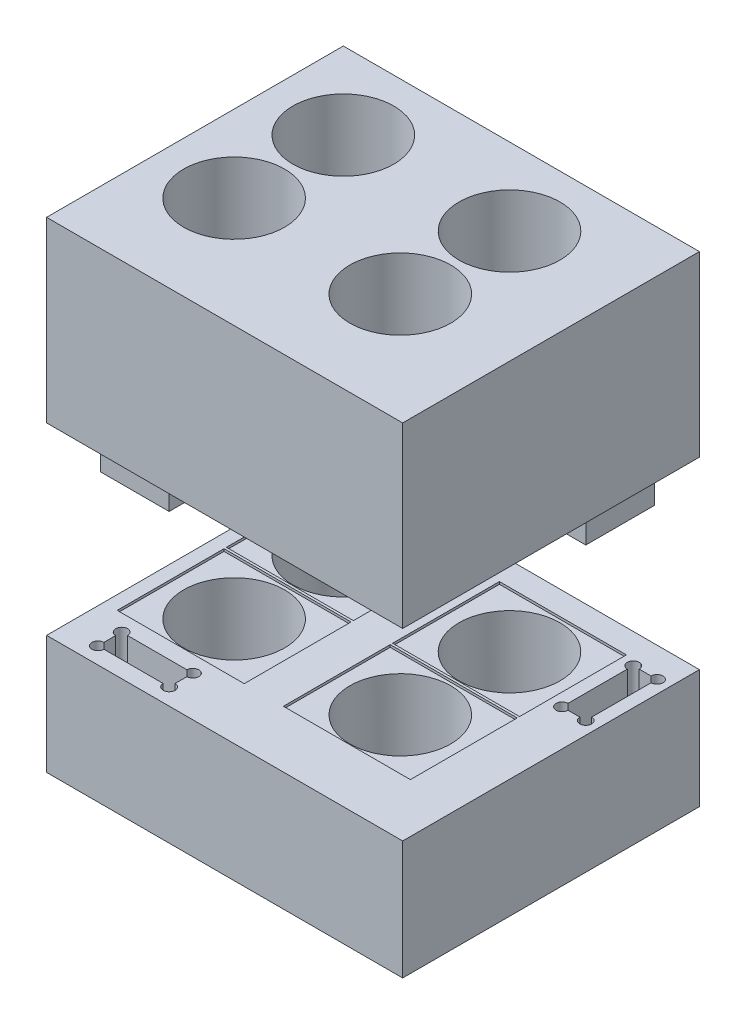
from build123d import *

# Parameters (mm, degrees)
SKETCH2_W             = 30
SKETCH2_H             = 25
SKETCH2_R             = 4.25
BOSS_EXTRUDE1_DEPTH   = 10
SKETCH4_W             = 10.7
SKETCH4_H             = 9
CUT_EXTRUDE1_DEPTH    = 0.2
CUT_EXTRUDE2_DEPTH    = 3
SKETCH6_W             = 5.8
SKETCH6_H             = 1.8
BOSS_EXTRUDE2_DEPTH   = 2.8
SKETCH6_W_2           = 1.8
SKETCH6_H_2           = 5.8
BOSS_EXTRUDE2_2_DEPTH = 2.8
SKETCH8_W             = 30
SKETCH8_H             = 25
SKETCH8_R             = 4.25
BOSS_EXTRUDE3_DEPTH   = 15
SHELL1_DEPTH          = 8.6
SHELL1_2_DEPTH        = 5.8
SHELL1_START          = 8.6
SHELL1_3_DEPTH        = 0.2


# Read off the part's stored shape, not the designer's step: Shell1
with BuildPart() as part:
    # Sketch2 → Boss-Extrude1 (new body)
    with BuildSketch(Plane(origin=(0, 0, 0), x_dir=(1, 0, 0), z_dir=(0, 1, 0))):
        with Locations((15, 12.5)):
            Rectangle(SKETCH2_W, SKETCH2_H)
        with Locations(Location((6.5, 18.5, 0), (0, 0, 270))):
            Circle(SKETCH2_R, mode=Mode.SUBTRACT)
        with Locations(Location((20.5, 18.5, 0), (0, 0, 270))):
            Circle(SKETCH2_R, mode=Mode.SUBTRACT)
        with Locations(Location((20.5, 9.3, 0), (0, 0, 270))):
            Circle(SKETCH2_R, mode=Mode.SUBTRACT)
        with Locations(Location((6.5, 9.3, 0), (0, 0, 270))):
            Circle(SKETCH2_R, mode=Mode.SUBTRACT)
    extrude(amount=BOSS_EXTRUDE1_DEPTH)

    # Sketch4 → Cut-Extrude1 (cut)
    with BuildSketch(Plane(origin=(0, 10, 0), x_dir=(1, 0, 0), z_dir=(0, 1, 0))):
        with Locations((6.5, 18.5)):
            Rectangle(SKETCH4_W, SKETCH4_H)
        with Locations((20.5, 18.5)):
            Rectangle(SKETCH4_W, SKETCH4_H)
        with Locations((20.5, 9.3)):
            Rectangle(SKETCH4_W, SKETCH4_H)
        with Locations((6.5, 9.3)):
            Rectangle(SKETCH4_W, SKETCH4_H)
    extrude(amount=-CUT_EXTRUDE1_DEPTH, mode=Mode.SUBTRACT)

    # Sketch5 → Cut-Extrude2 (cut)
    with BuildSketch(Plane(origin=(0, 10, 0), x_dir=(1, 0, 0), z_dir=(0, 1, 0))):
        with BuildLine():
            Line((3.427313979, 3.4), (8.422686021, 3.4))
            ThreePointArc((8.422686021, 3.4), (9.280189621, 3.755189621), (8.925, 2.897686021))
            Line((8.925, 2.897686021), (8.925, 1.902313979))
            ThreePointArc((8.925, 1.902313979), (9.280189621, 1.044810379), (8.422686021, 1.4))
            Line((8.422686021, 1.4), (3.427313979, 1.4))
            ThreePointArc((3.427313979, 1.4), (2.569810379, 1.044810379), (2.925, 1.902313979))
            Line((2.925, 1.902313979), (2.925, 2.897686021))
            ThreePointArc((2.925, 2.897686021), (2.569810379, 3.755189621), (3.427313979, 3.4))
        make_face()
        with BuildLine():
            Line((27.427313979, 16.5), (28.422686021, 16.5))
            ThreePointArc((28.422686021, 16.5), (29.280189621, 16.144810379), (28.925, 17.002313979))
            Line((28.925, 17.002313979), (28.925, 21.997686021))
            ThreePointArc((28.925, 21.997686021), (29.280189621, 22.855189621), (28.422686021, 22.5))
            Line((28.422686021, 22.5), (27.427313979, 22.5))
            ThreePointArc((27.427313979, 22.5), (26.569810379, 22.855189621), (26.925, 21.997686021))
            Line((26.925, 21.997686021), (26.925, 17.002313979))
            ThreePointArc((26.925, 17.002313979), (26.569810379, 16.144810379), (27.427313979, 16.5))
        make_face()
    extrude(amount=-CUT_EXTRUDE2_DEPTH, mode=Mode.SUBTRACT)

    # Shell1 outline → Shell1 (cut)
    with BuildSketch(Plane(origin=(0, 0, 0), x_dir=(1, 0, 0), z_dir=(0, 1, 0))):
        with BuildLine():
            Line((1.2, 23.8), (1.2, 19.76984251))
            ThreePointArc((1.2, 19.76984251), (2.646268043, 22.353731957), (5.23015749, 23.8))
            Line((5.23015749, 23.8), (1.2, 23.8))
        make_face()
        with BuildLine():
            ThreePointArc((1.2, 10.56984251), (2.0642459, 12.466478417), (3.577244451, 13.9))
            ThreePointArc((3.577244451, 13.9), (2.0642459, 15.333521583), (1.2, 17.23015749))
            Line((1.2, 17.23015749), (1.2, 10.56984251))
        make_face()
        with BuildLine():
            ThreePointArc((7.76984251, 23.8), (11.875590165, 19.397513442), (9.422755549, 13.9))
            ThreePointArc((9.422755549, 13.9), (11.946990168, 9.481102493), (9.721846281, 4.904296809))
            ThreePointArc((9.721846281, 4.904296809), (10.583302066, 3.784586976), (10.302633073, 2.4))
            ThreePointArc((10.302633073, 2.4), (10.572239397, 1.829505823), (10.615524441, 1.2))
            Line((10.615524441, 1.2), (28.8, 1.2))
            Line((28.8, 1.2), (28.8, 14.802281565))
            ThreePointArc((28.8, 14.802281565), (28.340175317, 14.901296471), (27.925, 15.122366927))
            ThreePointArc((27.925, 15.122366927), (26.412160351, 14.876772235), (25.315025831, 15.946957453))
            ThreePointArc((25.315025831, 15.946957453), (24.501977496, 14.8004492), (23.422755549, 13.9))
            ThreePointArc((23.422755549, 13.9), (20.5, 3.85), (17.577244451, 13.9))
            ThreePointArc((17.577244451, 13.9), (15.124409835, 19.397513442), (19.23015749, 23.8))
            Line((19.23015749, 23.8), (7.76984251, 23.8))
        make_face()
        with BuildLine():
            ThreePointArc((3.027851764, 5.099204049), (1.875579151, 6.416038868), (1.2, 8.03015749))
            Line((1.2, 8.03015749), (1.2, 1.2))
            Line((1.2, 1.2), (1.234475559, 1.2))
            ThreePointArc((1.234475559, 1.2), (1.277760603, 1.829505823), (1.547366927, 2.4))
            ThreePointArc((1.547366927, 2.4), (1.432454366, 4.218645475), (3.027851764, 5.099204049))
        make_face()
        with BuildLine():
            ThreePointArc((21.76984251, 23.8), (24.249899714, 22.454839078), (25.725, 20.049798374))
            Line((25.725, 20.049798374), (25.725, 21.29257593))
            ThreePointArc((25.725, 21.29257593), (25.224064461, 22.568492149), (25.825967296, 23.8))
            Line((25.825967296, 23.8), (21.76984251, 23.8))
        make_face()
    extrude(amount=SHELL1_DEPTH, mode=Mode.SUBTRACT)

    # Shell1 2 outline → Shell1 2 (cut)
    with BuildSketch(Plane(origin=(0, 0, 0), x_dir=(1, 0, 0), z_dir=(0, 1, 0))):
        with BuildLine():
            ThreePointArc((10.302633073, 2.4), (10.583302066, 3.784586976), (9.721846281, 4.904296809))
            ThreePointArc((9.721846281, 4.904296809), (6.341381038, 3.852308744), (3.027851764, 5.099204049))
            ThreePointArc((3.027851764, 5.099204049), (1.432454366, 4.218645475), (1.547366927, 2.4))
            ThreePointArc((1.547366927, 2.4), (1.277760603, 1.829505823), (1.234475559, 1.2))
            Line((1.234475559, 1.2), (10.615524441, 1.2))
            ThreePointArc((10.615524441, 1.2), (10.572239397, 1.829505823), (10.302633073, 2.4))
        make_face()
        with BuildLine():
            ThreePointArc((25.315025831, 15.946957453), (26.412160351, 14.876772235), (27.925, 15.122366927))
            ThreePointArc((27.925, 15.122366927), (28.340175317, 14.901296471), (28.8, 14.802281565))
            Line((28.8, 14.802281565), (28.8, 23.8))
            Line((28.8, 23.8), (25.825967296, 23.8))
            ThreePointArc((25.825967296, 23.8), (25.224064461, 22.568492149), (25.725, 21.29257593))
            Line((25.725, 21.29257593), (25.725, 20.049798374))
            ThreePointArc((25.725, 20.049798374), (25.92299323, 17.958110323), (25.315025831, 15.946957453))
        make_face()
    extrude(amount=SHELL1_2_DEPTH, mode=Mode.SUBTRACT)

    # Shell1 3 outline → Shell1 3 (cut)
    with BuildSketch(Plane(origin=(0, 0, 0), x_dir=(1, 0, 0), z_dir=(0, 1, 0)).offset(SHELL1_START)):
        with BuildLine():
            Line((13.95, 23.8), (13.05, 23.8))
            Line((13.05, 23.8), (13.05, 3.6))
            Line((13.05, 3.6), (10.615524441, 3.6))
            ThreePointArc((10.615524441, 3.6), (10.572239397, 2.970494177), (10.302633073, 2.4))
            ThreePointArc((10.302633073, 2.4), (10.572239397, 1.829505823), (10.615524441, 1.2))
            Line((10.615524441, 1.2), (28.8, 1.2))
            Line((28.8, 1.2), (28.8, 14.802281565))
            ThreePointArc((28.8, 14.802281565), (28.340175317, 14.901296471), (27.925, 15.122366927))
            ThreePointArc((27.925, 15.122366927), (27.509824683, 14.901296471), (27.05, 14.802281565))
            Line((27.05, 14.802281565), (27.05, 3.6))
            Line((27.05, 3.6), (13.95, 3.6))
            Line((13.95, 3.6), (13.95, 23.8))
        make_face()
        with BuildLine():
            ThreePointArc((1.547366927, 2.4), (1.277760603, 2.970494177), (1.23447556, 3.6))
            Line((1.23447556, 3.6), (1.2, 3.6))
            Line((1.2, 3.6), (1.2, 1.2))
            Line((1.2, 1.2), (1.234475559, 1.2))
            ThreePointArc((1.234475559, 1.2), (1.277760603, 1.829505823), (1.547366927, 2.4))
        make_face()
    extrude(amount=SHELL1_3_DEPTH, mode=Mode.SUBTRACT)


with BuildPart() as body_2:
    # Sketch6 → Boss-Extrude2 (new body)
    with BuildSketch(Plane(origin=(0, 7, 0), x_dir=(1, 0, 0), z_dir=(0, 1, 0))):
        with Locations((5.925, 2.4)):
            Rectangle(SKETCH6_W, SKETCH6_H)
    extrude(amount=BOSS_EXTRUDE2_DEPTH)


with BuildPart() as body_3:
    # Sketch6 → Boss-Extrude2 2 (new body)
    with BuildSketch(Plane(origin=(0, 7, 0), x_dir=(1, 0, 0), z_dir=(0, 1, 0))):
        with Locations((27.925, 19.5)):
            Rectangle(SKETCH6_W_2, SKETCH6_H_2)
    extrude(amount=BOSS_EXTRUDE2_2_DEPTH)


with BuildPart() as body_3_1:
    # Body-Move/Copy1: moved
    add(body_3.part.moved(Location((0, 0.2, 0))))



with BuildPart() as body_2_1:
    # Body-Move/Copy1: moved
    add(body_2.part.moved(Location((0, 0.2, 0))))


with BuildPart() as body_3_2:
    add(body_3_1.part)

    add(body_2_1.part)  # Boss-Extrude3 merges body 2
    # Sketch8 → Boss-Extrude3 (add)
    with BuildSketch(Plane(origin=(0, 10, 0), x_dir=(1, 0, 0), z_dir=(0, 1, 0))):
        with Locations((15, 12.5)):
            Rectangle(SKETCH8_W, SKETCH8_H)
        with Locations(Location((20.5, 9.3, 0), (0, 0, 90))):
            Circle(SKETCH8_R, mode=Mode.SUBTRACT)
        with Locations(Location((6.5, 9.3, 0), (0, 0, 90))):
            Circle(SKETCH8_R, mode=Mode.SUBTRACT)
        with Locations(Location((20.5, 18.5, 0), (0, 0, 90))):
            Circle(SKETCH8_R, mode=Mode.SUBTRACT)
        with Locations(Location((6.5, 18.5, 0), (0, 0, 270))):
            Circle(SKETCH8_R, mode=Mode.SUBTRACT)
    extrude(amount=BOSS_EXTRUDE3_DEPTH)


with BuildPart() as body_3_3:
    # Body-Move/Copy2: moved
    add(body_3_2.part.moved(Location((0, 15.5, 0))))


solid = Compound([part.part, body_3_3.part])
